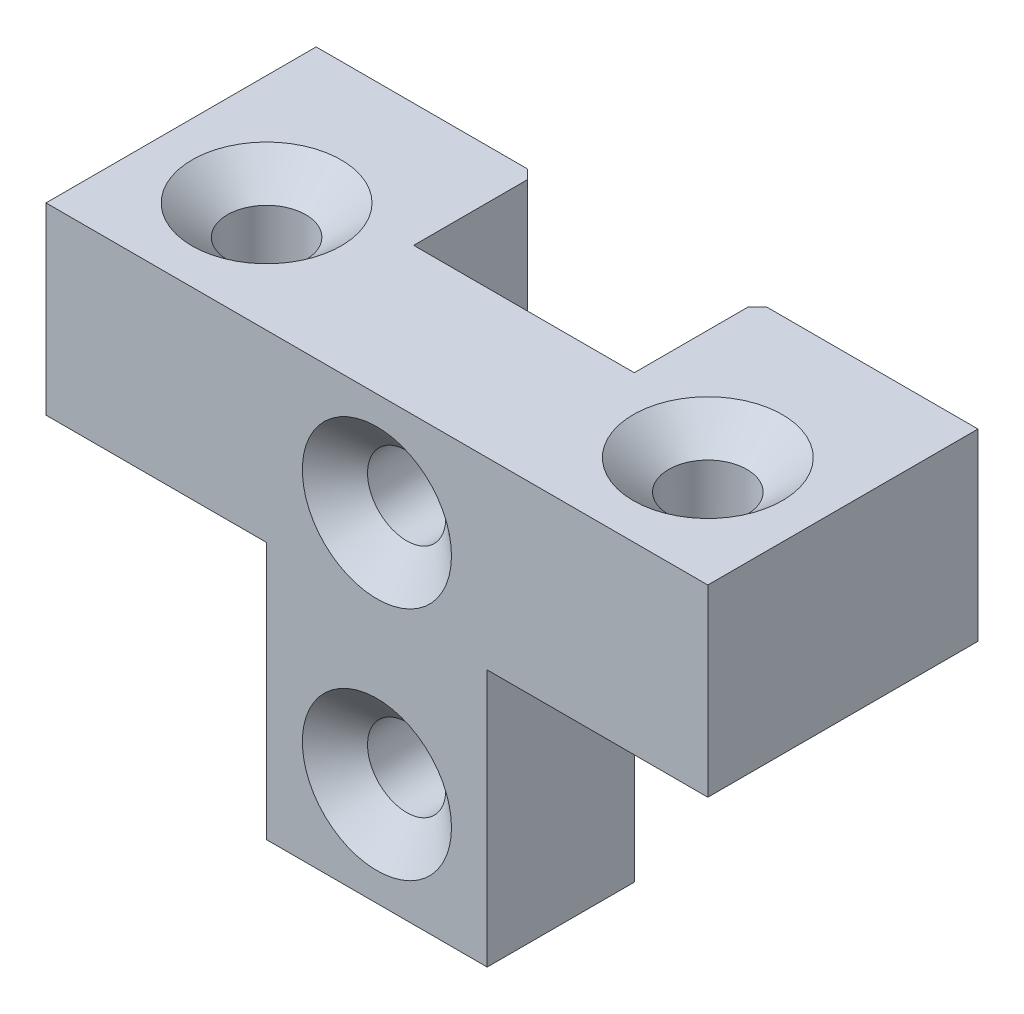
from build123d import *

# Parameters (mm, degrees)
BOSS_EXTRUDE1_DEPTH                                 = 12.7
CSK_FOR_1_4_FLAT_HEAD_MACHINE_SCREW_100_D           = 6.7564
CSK_FOR_1_4_FLAT_HEAD_MACHINE_SCREW_100_CSINK_D     = 12.8778
CSK_FOR_1_4_FLAT_HEAD_MACHINE_SCREW_100_CSINK_ANGLE = 100
SKETCH6_W                                           = 19.05
SKETCH6_H                                           = 15.875
BOSS_EXTRUDE2_DEPTH                                 = 10.6299
CSK_FOR_1_4_FLAT_HEAD_MACHINE_SCREW_2_D             = 6.7564
CSK_FOR_1_4_FLAT_HEAD_MACHINE_SCREW_2_CSINK_D       = 12.8778
CSK_FOR_1_4_FLAT_HEAD_MACHINE_SCREW_2_CSINK_ANGLE   = 100
CHAMFER1_SIZE                                       = 0.79375


with BuildPart() as part:
    # Sketch1 → Boss-Extrude1 (new body)
    with BuildSketch(Plane.XY):
        Polygon((-28.575, 19.05), (28.575, 19.05), (28.575, 3.175), (19.05, 3.175), (9.525, 3.175), (9.525, -19.05), (-9.525, -19.05), (-9.525, 3.175), (-19.05, 3.175), (-28.575, 3.175), align=None)
    extrude(amount=-BOSS_EXTRUDE1_DEPTH)

    # CSK for 1_4 Flat Head Machine Screw _100 (through all)
    with Locations(Plane.XY):
        with Locations((0, 10.16), (0, -10.16)):
            CounterSinkHole(CSK_FOR_1_4_FLAT_HEAD_MACHINE_SCREW_100_D / 2, CSK_FOR_1_4_FLAT_HEAD_MACHINE_SCREW_100_CSINK_D / 2, counter_sink_angle=CSK_FOR_1_4_FLAT_HEAD_MACHINE_SCREW_100_CSINK_ANGLE)

    # Sketch6 → Boss-Extrude2 (add)
    with BuildSketch(Plane.XY.offset(-12.7)):
        with Locations((-19.05, 11.1125)):
            Rectangle(SKETCH6_W, SKETCH6_H)
        with Locations((19.05, 11.1125)):
            Rectangle(SKETCH6_W, SKETCH6_H)
    extrude(amount=-BOSS_EXTRUDE2_DEPTH)

    # CSK for 1_4 Flat Head Machine Screw  2 (through all)
    with Locations(Plane(origin=(0, 19.05, 0), x_dir=(1, 0, 0), z_dir=(0, 1, 0))):
        with Locations((-19.05, 9.525), (19.05, 9.525)):
            CounterSinkHole(CSK_FOR_1_4_FLAT_HEAD_MACHINE_SCREW_2_D / 2, CSK_FOR_1_4_FLAT_HEAD_MACHINE_SCREW_2_CSINK_D / 2, counter_sink_angle=CSK_FOR_1_4_FLAT_HEAD_MACHINE_SCREW_2_CSINK_ANGLE)

    # Chamfer1
    chamfer1_edges = [part.edges().sort_by_distance(p)[0] for p in [
        (-9.525, 11.1125, -23.3299),
        (9.525, 11.1125, -23.3299),
    ]]
    chamfer(chamfer1_edges, length=CHAMFER1_SIZE)


solid = part.part
